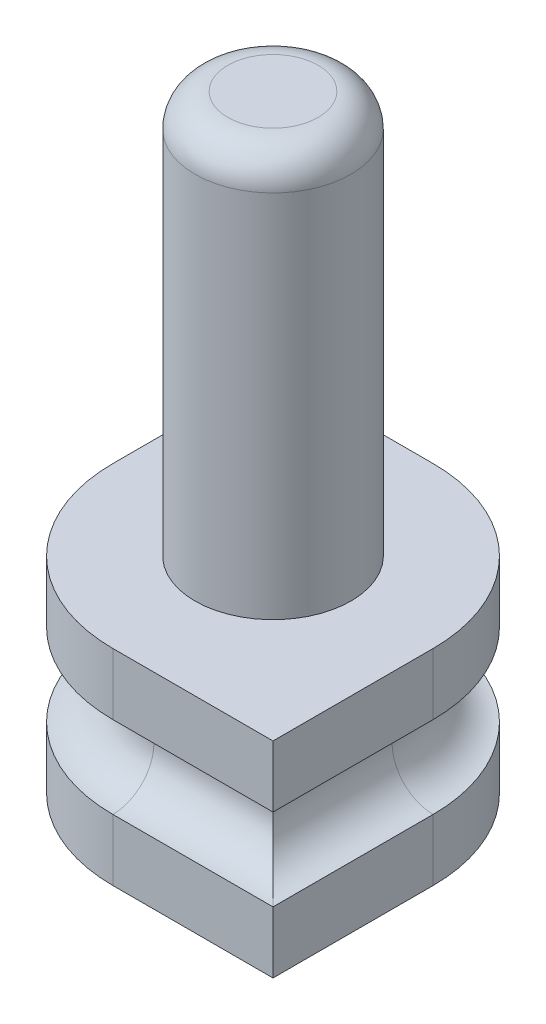
from build123d import *

# Parameters (mm, degrees)
BOSS_EXTRUDE1_DEPTH     = 5
SKETCH2_R               = 1.9
BOSS_EXTRUDE2_DEPTH     = 9.8
CUT_EXTRUDE2_DEPTH      = 1
CUT_EXTRUDE2_DEPTH_BACK = 1
FILLET1_R               = 1
FILLET2_R               = 0.8


with BuildPart() as part:
    # Sketch1 → Boss-Extrude1 (new body)
    with BuildSketch(Plane(origin=(0, 0, 0), x_dir=(1, 0, 0), z_dir=(0, 1, 0))):
        with BuildLine():
            Line((-3.9, 3.9), (0, 3.9))
            ThreePointArc((0, 3.9), (2.757716447, 2.757716447), (3.9, 0))
            Line((3.9, 0), (3.9, -3.9))
            Line((3.9, -3.9), (0, -3.9))
            ThreePointArc((0, -3.9), (-2.757716447, -2.757716447), (-3.9, 0))
            Line((-3.9, 0), (-3.9, 3.9))
        make_face()
    extrude(amount=BOSS_EXTRUDE1_DEPTH)

    # Sketch2 → Boss-Extrude2 (add)
    with BuildSketch(Plane(origin=(0, 5, 0), x_dir=(1, 0, 0), z_dir=(0, 1, 0))):
        with Locations(Location((0, 0, 0), (0, 0, 270))):
            Circle(SKETCH2_R)
    extrude(amount=BOSS_EXTRUDE2_DEPTH)

    # Sketch3 → Cut-Extrude2 (cut, two sides: drawn at the far end of the back side and taken through both)
    with BuildSketch(Plane(origin=(0, 2.5, 0), x_dir=(1, 0, 0), z_dir=(0, 1, 0)).offset(-CUT_EXTRUDE2_DEPTH_BACK)):
        with BuildLine():
            Line((-3.9, 0), (-3.9, 3.9))
            Line((-3.9, 3.9), (0, 3.9))
            ThreePointArc((0, 3.9), (2.757716447, 2.757716447), (3.9, 0))
            Line((3.9, 0), (3.9, -3.9))
            Line((3.9, -3.9), (0, -3.9))
            ThreePointArc((0, -3.9), (-2.757716447, -2.757716447), (-3.9, 0))
        make_face()
        with BuildLine():
            Line((-2.9, 0), (-2.9, 2.9))
            Line((-2.9, 2.9), (0, 2.9))
            ThreePointArc((0, 2.9), (2.050609665, 2.050609665), (2.9, 0))
            Line((2.9, 0), (2.9, -2.9))
            Line((2.9, -2.9), (0, -2.9))
            ThreePointArc((0, -2.9), (-2.050609665, -2.050609665), (-2.9, 0))
        make_face(mode=Mode.SUBTRACT)
    extrude(amount=CUT_EXTRUDE2_DEPTH + CUT_EXTRUDE2_DEPTH_BACK, mode=Mode.SUBTRACT)

    # Fillet1
    fillet1_edges = [part.edges().sort_by_distance(p)[0] for p in [
        (2.9, 3.5, 1.45),
        (2.050609665, 3.5, -2.050609665),
        (1.45, 3.5, 2.9),
        (-2.050609665, 3.5, 2.050609665),
        (2.9, 1.5, 1.45),
        (2.050609665, 1.5, -2.050609665),
        (-2.9, 1.5, -1.45),
        (1.45, 1.5, 2.9),
        (-1.45, 3.5, -2.9),
        (-2.9, 3.5, -1.45),
        (-1.45, 1.5, -2.9),
        (-2.050609665, 1.5, 2.050609665),
    ]]
    fillet(fillet1_edges, radius=FILLET1_R - 0.0001)  # a hair under: the kernel refuses the full size

    # Fillet2
    fillet2_edges = [part.edges().sort_by_distance(p)[0] for p in [
        (0, 14.8, -1.9),
    ]]
    fillet(fillet2_edges, radius=FILLET2_R)


solid = part.part
